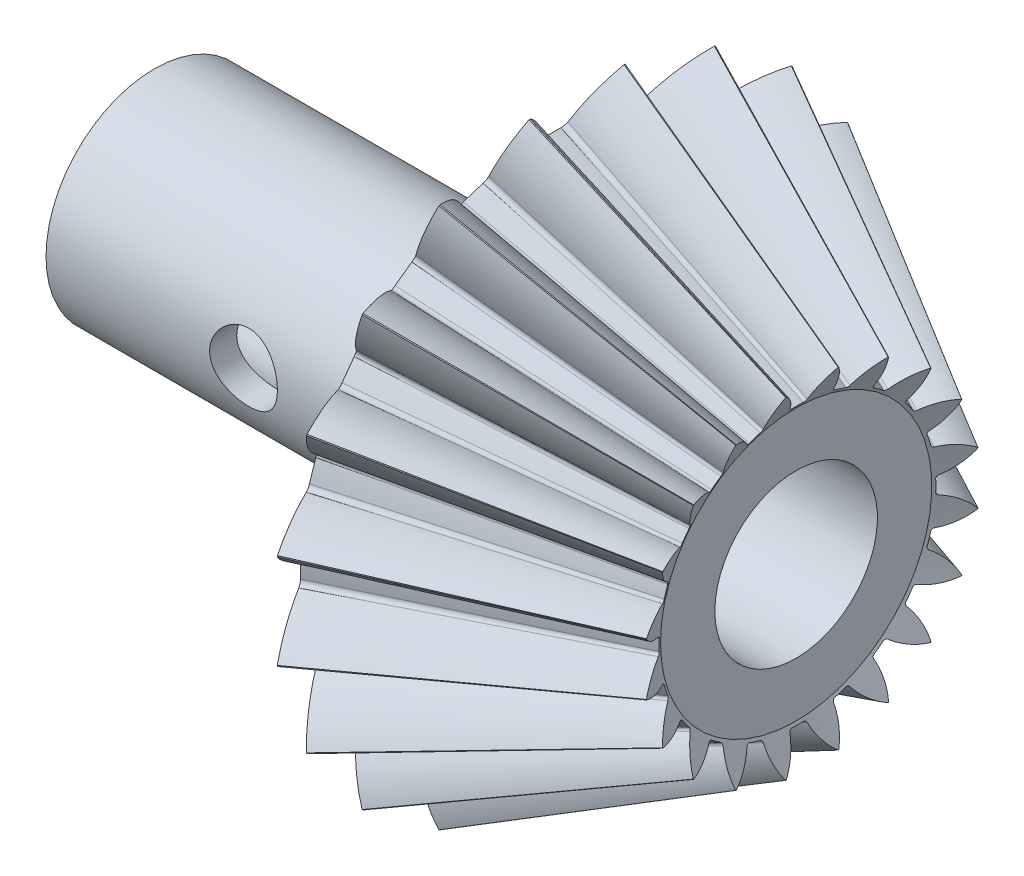
from build123d import *

# Parameters (mm, degrees)
TEETHCUTS_COUNT         = 20
TEETHCUTS_ANGLE         = 342
HUBSKE_R                = 4
HUB_DEPTH               = 14.528291257
BORSKE_R                = 3
BORE_DEPTH              = 35.0000508
CUT_EXTRUDE1_DEPTH      = 22.35614266
CUT_EXTRUDE1_DEPTH_BACK = 22.35614266
SKETCH2_R               = 1.25


with BuildPart() as part:
    # BasProSke → Base-Revolve (revolve)
    with BuildSketch(Plane(origin=(0, 0, 0), x_dir=(1, 0, 0), z_dir=(0, 1, 0)), mode=Mode.PRIVATE) as base_revolve_sk:
        Polygon((0, 0), (0, 9.056379314), (1.07331263, 11.203004572), (9.748584537, 6.192868611), (9.155271908, 5.006243354), (9.155271908, 0), align=None)
    revolve(base_revolve_sk.sketch.rotate(Axis((-10, 0, 0), (1, 0, 0)), 180), axis=Axis((-10, 0, 0), (1, 0, 0)))

    # ToothCut: read off the stored shape, not the designer's step
    # ToothCut: loft between two sections, ruled curve by curve
    toothcut_from = [
        Edge.make_bspline([(20.475175686, 0.006730684, -0.010230454), (20.472620769, 0.00162085, -0.014432703), (20.469472441, -0.004675805, -0.01357417), (20.467444062, -0.008732563, -0.008122078)], [0, 0, 0, 0, 1, 1, 1, 1], 3, [1, 0.818595861, 0.818595861, 1]),
        Edge.make_bspline([(20.467444062, -0.008732563, 0.008122078), (20.469472441, -0.004675805, 0.01357417), (20.472620769, 0.00162085, 0.014432703), (20.475175686, 0.006730684, 0.010230454)], [0, 0, 0, 0, 1, 1, 1, 1], 3, [1, 0.818595861, 0.818595861, 1]),
        Edge.make_bspline([(20.467444062, -0.008732563, -0.008122078), (20.467124412, -0.009371863, -0.007262889), (20.466857955, -0.009904777, -0.006317325), (20.466649302, -0.010322084, -0.005301744)], [0, 0, 0, 0, 1, 1, 1, 1], 3, [1, 0.994233588, 0.994233588, 1]),
        Edge.make_bspline([(20.466649302, -0.010322084, 0.005301744), (20.466857955, -0.009904777, 0.006317325), (20.467124412, -0.009371863, 0.007262889), (20.467444062, -0.008732563, 0.008122078)], [0, 0, 0, 0, 1, 1, 1, 1], 3, [1, 0.994233588, 0.994233588, 1]),
        Edge.make_bspline([(20.466649302, -0.010322084, -0.005301744), (20.465946663, -0.011727361, -0.001881792), (20.465946663, -0.011727361, 0.001881792), (20.466649302, -0.010322084, 0.005301744)], [0, 0, 0, 0, 1, 1, 1, 1], 3, [1, 0.939130155, 0.939130155, 1]),
        Edge.make_line((20.475175686, 0.006730684, 0.010230454), (20.475175686, 0.006730684, -0.010230454)),
    ]
    toothcut_to = [
        Edge.make_bspline([(1.101068829, 11.258516969, -1.946212593), (0.857940224, 10.77225976, -1.2651625), (0.53110282, 10.118584953, -0.790532769), (0.153974829, 9.364328972, -0.570852964)], [0, 0, 0, 0, 1, 1, 1, 1], 3, [1, 0.965917598, 0.965917598, 1]),
        Edge.make_bspline([(0.153974829, 9.364328972, 0.570852964), (0.53110282, 10.118584953, 0.790532769), (0.857940224, 10.77225976, 1.2651625), (1.101068829, 11.258516969, 1.946212593)], [0, 0, 0, 0, 1, 1, 1, 1], 3, [1, 0.965917598, 0.965917598, 1]),
        Edge.make_bspline([(0.153974829, 9.364328972, -0.570852964), (0.113805435, 9.283990183, -0.547453999), (0.089108685, 9.234596684, -0.472849938), (0.090831971, 9.238043256, -0.380110711)], [0, 0, 0, 0, 1, 1, 1, 1], 3, [1, 0.852242502, 0.852242502, 1]),
        Edge.make_bspline([(0.090831971, 9.238043256, 0.380110711), (0.089108685, 9.234596684, 0.472849938), (0.113805435, 9.283990183, 0.547453999), (0.153974829, 9.364328972, 0.570852964)], [0, 0, 0, 0, 1, 1, 1, 1], 3, [1, 0.852242502, 0.852242502, 1]),
        Edge.make_bspline([(0.090831971, 9.238043256, -0.380110711), (0.095539445, 9.247458203, -0.126776434), (0.095539445, 9.247458203, 0.126776434), (0.090831971, 9.238043256, 0.380110711)], [0, 0, 0, 0, 1, 1, 1, 1], 3, [1, 0.999425256, 0.999425256, 1]),
        Edge.make_line((1.101068829, 11.258516969, 1.946212593), (1.101068829, 11.258516969, -1.946212593)),
    ]
    toothcut = Solid(Shell([*[Face.make_surface_from_curves(toothcut_from[k], toothcut_to[k]) for k in range(6)], Face(Wire(toothcut_from)), Face(Wire(toothcut_to))]))
    add(toothcut, mode=Mode.SUBTRACT)

    # TeethCuts: ToothCut ×20 about axis
    teethcuts_axis = Axis((-10, 0, 0), (1, 0, 0))
    for i in range(1, TEETHCUTS_COUNT):
        add(toothcut.rotate(teethcuts_axis, i * TEETHCUTS_ANGLE / (TEETHCUTS_COUNT - 1)), mode=Mode.SUBTRACT)

    # HubSke → Hub (add)
    with BuildSketch(Plane.ZY):
        with Locations(Location((0, 0, 0), (0, 0, 180))):
            Circle(HUBSKE_R)
    extrude(amount=HUB_DEPTH)

    # BorSke → Bore (cut, symmetric)
    with BuildSketch(Plane(origin=(0, 0, 0), x_dir=(0, 0, -1), z_dir=(1, 0, 0))):
        with Locations(Location((0, 0, 0), (0, 0, 180))):
            Circle(BORSKE_R)
    extrude(amount=BORE_DEPTH, both=True, mode=Mode.SUBTRACT)

    # Sketch2 → Cut-Extrude1 (cut, two sides: drawn at the far end of the back side and taken through both)
    with BuildSketch(Plane.XY.offset(-CUT_EXTRUDE1_DEPTH_BACK)):
        with Locations((-7.24, 0)):
            Circle(SKETCH2_R)
    extrude(amount=CUT_EXTRUDE1_DEPTH + CUT_EXTRUDE1_DEPTH_BACK, mode=Mode.SUBTRACT)


solid = part.part
